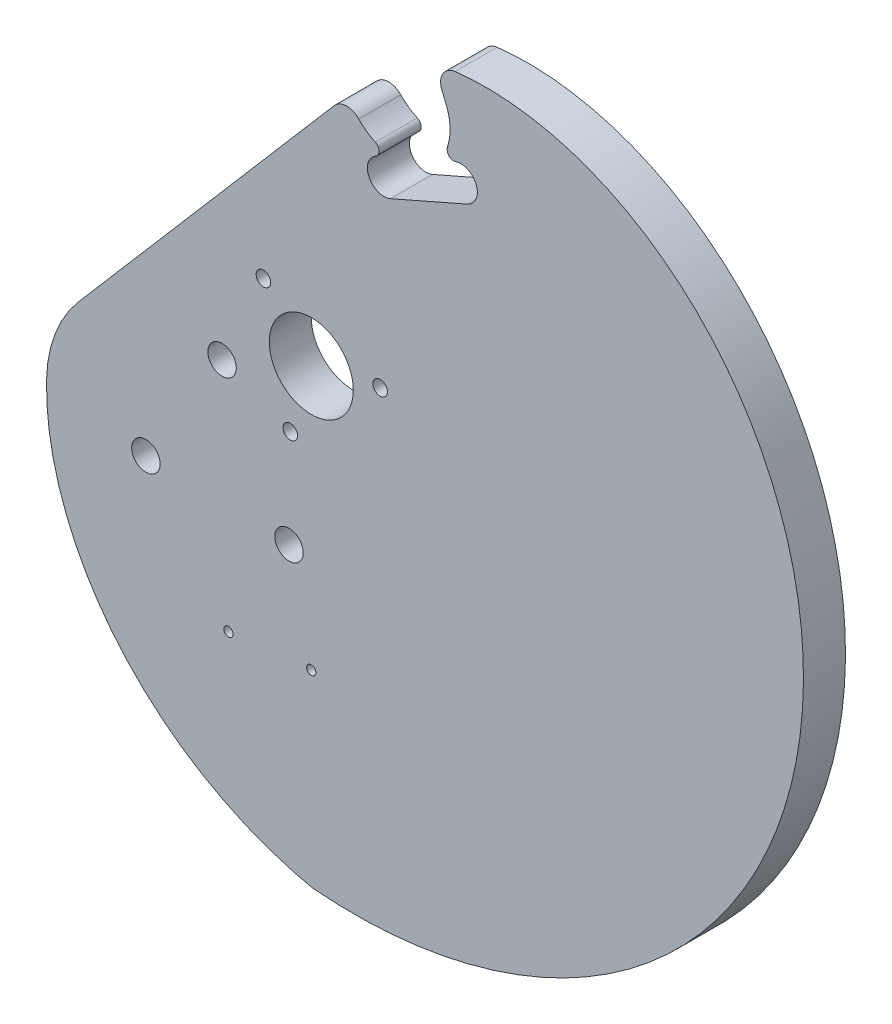
from build123d import *

# Parameters (mm, degrees)
SKETCH1_R               = 6.35
BOSS_EXTRUDE1_DEPTH     = 3.175
CUT_EXTRUDE1_DEPTH      = 102.208623711
CUT_EXTRUDE1_DEPTH_BACK = 102.208623711
FILLET1_R               = 20
FILLET2_R               = 2.5
FILLET3_R               = 1
M4_CLEARANCE_HOLE1_D    = 4.3
M2_CLEARANCE_HOLE1_D    = 2.2
SKETCH18_R              = 0.7
CUT_EXTRUDE5_DEPTH      = 102.357917249


with BuildPart() as part:
    # Sketch1 → Boss-Extrude1 (new, symmetric)
    with BuildSketch(Plane.XY):
        with BuildLine():
            ThreePointArc((11.984914181, 27.895733584), (8.691133377, 29.180649151), (9.976048944, 32.474429955))
            Line((9.976048944, 32.474429955), (12.234616167, 33.46535768))
            ThreePointArc((12.234616167, 33.46535768), (8.26006825, 34.969173712), (5.615201844, 38.295308932))
            Line((5.615201844, 38.295308932), (3.856119442, 42.419673356))
            add(Edge.make_bspline(
                [(3.856119442, 42.419673356), (3.804269194, 42.380475154), (3.486745937, 42.138972836), (2.912619563, 41.685826384), (2.149082762, 41.044776761), (1.408732666, 40.385653153), (0.69201842, 39.710962437), (-0.000702823, 39.023274092), (-0.669224606, 38.325164066), (-1.313490613, 37.619209289), (-1.933594741, 36.907981167), (-2.529780734, 36.194039342), (-3.102441662, 35.479925366), (-3.652119172, 34.768156406), (-4.179502537, 34.061218936), (-4.68542751, 33.361562432), (-5.170874981, 32.671593072), (-5.636969475, 31.993667421), (-6.084977486, 31.330086125), (-6.5163057, 30.68308757), (-6.932499191, 30.054841594), (-7.335239472, 29.447442991), (-7.726343211, 28.862905788), (-8.107759261, 28.30315506), (-8.481572996, 27.770028153), (-8.850055929, 27.265150233), (-9.21599154, 26.789707359), (-9.58007402, 26.342396401), (-9.943199031, 25.921274986), (-10.306211946, 25.524302901), (-10.669815304, 25.149428396), (-11.03457423, 24.794597749), (-11.400917427, 24.457759077), (-11.769139802, 24.136868148), (-12.139404915, 23.829894257), (-12.511747444, 23.534826559), (-12.886075425, 23.249680558), (-13.262172288, 22.972504592), (-13.639698706, 22.701386132), (-14.018194373, 22.4344578), (-14.397079826, 22.169903041), (-14.775658393, 21.905961469), (-15.153118349, 21.640933911), (-15.528535328, 21.37318718), (-15.900874865, 21.101158728), (-16.268995598, 20.823360748), (-16.631651048, 20.538385549), (-16.987497448, 20.244905703), (-17.335071725, 19.941700072), (-17.674482118, 19.629485326), (-18.005889299, 19.308945872), (-18.329486913, 18.98074786), (-18.645506177, 18.6455329), (-18.954213469, 18.303917657), (-19.255909475, 17.956492143), (-19.550927855, 17.603818409), (-19.839633983, 17.246429189), (-20.122423608, 16.884826615), (-20.39972148, 16.519480973), (-20.671979932, 16.15082951), (-20.93967742, 15.77927529), (-21.203317027, 15.405186109), (-21.463424922, 15.028893458), (-21.720548787, 14.650691546), (-21.975256201, 14.270836377), (-22.228133, 13.889544888), (-22.479781587, 13.506994147), (-22.730819224, 13.123320602), (-22.981876279, 12.738619403), (-23.233594452, 12.35294377), (-23.486624965, 11.966304432), (-23.741626724, 11.578669117), (-23.999264462, 11.189962103), (-24.260206854, 10.800063825), (-24.52512461, 10.408810538), (-24.794688561, 10.015994037), (-25.069567717, 9.621361426), (-25.350427363, 9.224614974), (-25.637926993, 8.8254119), (-25.932718851, 8.423364715), (-26.235444149, 8.018039723), (-26.546738212, 7.608962846), (-26.867193334, 7.195608336), (-27.197393741, 6.777566684), (-27.537037782, 6.353934602), (-27.885559202, 5.923803469), (-28.242374703, 5.486366009), (-28.606855737, 5.040842301), (-28.978345064, 4.586492757), (-29.356154138, 4.122615768), (-29.739565815, 3.648549546), (-30.127835637, 3.163672741), (-30.520193566, 2.667405334), (-30.915845631, 2.159209384), (-31.313975642, 1.638589743), (-31.713746908, 1.10509472), (-32.114303997, 0.558316687), (-32.514774496, -0.002107372), (-32.914270801, -0.576495363), (-33.311891916, -1.165119646), (-33.70672526, -1.768206653), (-34.097848491, -2.385936568), (-34.484331334, -3.01844306), (-34.865237414, -3.665813085), (-35.239626095, -4.328086735), (-35.606554319, -5.00525716), (-35.965078448, -5.697270543), (-36.314256102, -6.404026134), (-36.653147994, -7.125376348), (-36.98081976, -7.861126926), (-37.296343783, -8.611037148), (-37.598801011, -9.374820113), (-37.887282738, -10.15214308), (-38.160892488, -10.942627847), (-38.418747446, -11.745851279), (-38.659981522, -12.561345551), (-38.883742182, -13.388599746), (-39.089211497, -14.227059816), (-39.27554787, -15.076191303), (-39.442240692, -15.935443066), (-39.58900499, -16.804297383), (-39.715531283, -17.682274795), (-39.821534024, -18.56888584), (-39.906736403, -19.463633732), (-39.970874682, -20.366013757), (-40.01369729, -21.27551381), (-40.034965324, -22.191614638), (-40.034452659, -23.113790166), (-40.011946156, -24.041507803), (-39.967245835, -24.974228766), (-39.900165044, -25.911408403), (-39.810530622, -26.852496518), (-39.698183052, -27.796937709), (-39.56297661, -28.744171699), (-39.4047795, -29.693633681), (-39.223473982, -30.64475466), (-39.018956498, -31.596961802), (-38.791137779, -32.549678783), (-38.539942955, -33.502326148), (-38.265311644, -34.454321664), (-37.967198044, -35.405080681), (-37.645571006, -36.354016496), (-37.300414107, -37.300540716), (-36.931725709, -38.244063627), (-36.539519007, -39.18399456), (-36.123822074, -40.119742265), (-35.684677893, -41.050715279), (-35.222144381, -41.976322302), (-34.736294403, -42.89597257), (-34.227215775, -43.809076229), (-33.695011264, -44.715044715), (-33.139798572, -45.613291121), (-32.561710315, -46.503230581), (-31.960893988, -47.384280643), (-31.337511928, -48.255861642), (-30.69174126, -49.117397078), (-30.023773839, -49.96831399), (-29.333816181, -50.808043326), (-28.622089382, -51.636020317), (-27.888829033, -52.451684847), (-27.134285123, -53.25448182), (-26.358721931, -54.04386153), (-25.562417912, -54.819280022), (-24.745665571, -55.580199454), (-23.908771332, -56.326088459), (-23.052055394, -57.0564225), (-22.175851579, -57.770684224), (-21.280507172, -58.468363812), (-20.366382752, -59.148959324), (-19.433852012, -59.811977048), (-18.483301577, -60.456931829), (-17.515130802, -61.083347415), (-16.529751575, -61.690756781), (-15.527588097, -62.278702456), (-14.50907667, -62.846736843), (-13.474665463, -63.39442255), (-12.424814268, -63.921332635), (-11.359994294, -64.427051169), (-10.280687768, -64.911172569), (-9.187388219, -65.373305515), (-8.080598179, -65.813059652), (-6.960836498, -66.230096831), (-5.828609627, -66.623940268), (-4.684517934, -66.994691537), (-3.528855652, -67.340343195), (-2.3631095, -67.666856553), (-1.184338477, -67.950378607), (-0.400093515, -68.169065005), (0, -68.230921715)],
                knots=[0.595074645, 0.595074645, 0.595074645, 0.595074645, 0.59561552, 0.598394199, 0.601160164, 0.603910525, 0.606641733, 0.609350191, 0.612032273, 0.614684334, 0.617302722, 0.619883791, 0.622423916, 0.624919509, 0.627367038, 0.629763043, 0.632104166, 0.634387177, 0.636609005, 0.638766786, 0.640857908, 0.642880081, 0.644831406, 0.646710483, 0.648516525, 0.650249514, 0.65191136, 0.653508519, 0.655048349, 0.65653798, 0.657984241, 0.659393583, 0.66077201, 0.662125022, 0.663457568, 0.664774018, 0.666078151, 0.667373165, 0.668661696, 0.669945853, 0.671227263, 0.672507127, 0.673786273, 0.67506522, 0.676344239, 0.677623416, 0.678902717, 0.68018205, 0.681461324, 0.682740438, 0.684019262, 0.685297659, 0.686575488, 0.687852615, 0.689128915, 0.690404281, 0.691678632, 0.692951916, 0.694224122, 0.695495279, 0.696765474, 0.698034846, 0.699303605, 0.70057203, 0.70184048, 0.703109399, 0.704379325, 0.705650892, 0.706924838, 0.708202013, 0.709483377, 0.710770009, 0.712063109, 0.713363997, 0.714674119, 0.715995039, 0.717328447, 0.718676146, 0.720040056, 0.721422204, 0.722824718, 0.724249822, 0.725699824, 0.727177002, 0.72868281, 0.730218172, 0.731783831, 0.733380363, 0.735008197, 0.736667628, 0.738358831, 0.740081872, 0.741836722, 0.743623264, 0.745441305, 0.747290584, 0.749170776, 0.751081502, 0.753022336, 0.754992805, 0.756992401, 0.759020578, 0.761076761, 0.763160347, 0.76527071, 0.767407202, 0.769569155, 0.771755887, 0.7739667, 0.776200882, 0.778457713, 0.780736462, 0.783036392, 0.785356757, 0.787696808, 0.790055792, 0.792432952, 0.794827532, 0.797238799, 0.799666426, 0.802110394, 0.804570687, 0.807047284, 0.809540165, 0.812049305, 0.814574675, 0.817116246, 0.819673984, 0.822247852, 0.824837811, 0.82744382, 0.830065834, 0.832703806, 0.835357687, 0.838027424, 0.840712962, 0.843414244, 0.84613121, 0.848863798, 0.851611942, 0.854375576, 0.857154631, 0.859949033, 0.862758708, 0.865583582, 0.868423573, 0.871278601, 0.874148584, 0.877033434, 0.879933066, 0.882847387, 0.885776307, 0.888719732, 0.891677564, 0.894649707, 0.897636058, 0.900636516, 0.903650977, 0.906679333, 0.909721476, 0.912777297, 0.915846682, 0.918929518, 0.922025687, 0.925135072, 0.928257554, 0.931393009, 0.934541315, 0.937702347, 0.940875975, 0.944062073, 0.947260508, 0.950471149, 0.95369386, 0.956928506, 0.960174949, 0.96343305, 0.966702667, 0.969983657, 0.973275876, 0.976579178, 0.979893415, 0.983218438, 0.986554095, 0.989900235, 0.993256703, 0.996623344, 1, 1, 1, 1], degree=3))
            add(Edge.make_bspline(
                [(0, -68.230921715), (0.393333706, -68.291733321), (1.194961176, -68.321276753), (2.388868431, -68.414811628), (3.58891617, -68.470136134), (4.791044831, -68.510535556), (5.995946289, -68.52954927), (7.203026535, -68.528713614), (8.412027616, -68.507423129), (9.62259203, -68.465654591), (10.83437986, -68.403235569), (12.047037443, -68.320041284), (13.260205927, -68.215942066), (14.473519127, -68.090817818), (15.686604264, -67.944554476), (16.899081946, -67.777045295), (18.110566359, -67.588190842), (19.320665416, -67.377899329), (20.528980925, -67.146086849), (21.73510877, -66.892677633), (22.938639087, -66.6176043), (24.139156466, -66.320808097), (25.336240146, -66.002239142), (26.529464226, -65.661856654), (27.718397887, -65.299629187), (28.90260561, -64.915534847), (30.081647414, -64.509561514), (31.255079097, -64.081707052), (32.42245248, -63.631979515), (33.58331567, -63.160397343), (34.737213315, -62.666989561), (35.883686879, -62.151795956), (37.022274916, -61.614867262), (38.152513354, -61.056265327), (39.273935784, -60.476063279), (40.386073758, -59.87434568), (41.488457085, -59.251208675), (42.580614147, -58.606760131), (43.662072205, -57.941119771), (44.732357722, -57.254419292), (45.790996682, -56.546802486), (46.837514925, -55.81842534), (47.871438475, -55.069456136), (48.89229388, -54.300075538), (49.899608554, -53.51047667), (50.892911122, -52.700865183), (51.871731772, -51.87145932), (52.835602603, -51.022489959), (53.784057989, -50.154200657), (54.71663493, -49.26684768), (55.632873421, -48.360700021), (56.532316811, -47.436039411), (57.414512174, -46.493160317), (58.279010671, -45.532369935), (59.125367928, -44.553988165), (59.953144401, -43.558347582), (60.761905749, -42.545793391), (61.55122321, -41.516683378), (62.320673971, -40.471387842), (63.069841543, -39.410289525), (63.798316132, -38.333783527), (64.505695017, -37.242277204), (65.191582915, -36.13619007), (65.85559236, -35.015953676), (66.497344063, -33.882011479), (67.11646729, -32.734818707), (67.71260022, -31.574842209), (68.285390316, -30.402560293), (68.834494677, -29.218462553), (69.359580408, -28.023049692), (69.860324965, -26.816833323), (70.336416512, -25.60033577), (70.787554269, -24.374089852), (71.213448854, -23.13863866), (71.613822626, -21.894535318), (71.988410015, -20.642342743), (72.336957858, -19.382633384), (72.659225719, -18.115988959), (72.954986211, -16.843000179), (73.224025309, -15.564266461), (73.466142659, -14.28039563), (73.681151874, -12.992003617), (73.868880836, -11.699714142), (74.029171977, -10.404158388), (74.161882563, -9.10597467), (74.266884966, -7.805808087), (74.344066927, -6.504310174), (74.393331816, -5.202138538), (74.414598879, -3.89995649), (74.407803478, -2.598432666), (74.372897323, -1.29824064), (74.309848696, -5.853e-05), (74.218642658, 1.295431404), (74.099281259, 2.587543173), (73.95178373, 3.875587471), (73.776186663, 5.158872107), (73.572544188, 6.43670243), (73.340928136, 7.708381771), (73.081428188, 8.973211889), (72.794152019, 10.230493418), (72.47922543, 11.479526328), (72.13679246, 12.719610386), (71.767015501, 13.950045625), (71.37007539, 15.170132817), (70.946171493, 16.379173951), (70.495521777, 17.576472716), (70.018362872, 18.761334989), (69.514950114, 19.933069325), (68.985557583, 21.090987453), (68.430478125, 22.234404772), (67.850023359, 23.362640855), (67.244523678, 24.47501995), (66.614328227, 25.570871489), (65.959804877, 26.649530597), (65.281340181, 27.710338599), (64.579339317, 28.752643533), (63.85422602, 29.775800665), (63.106442497, 30.779173), (62.33644933, 31.762131799), (61.544725366, 32.724057086), (60.731767601, 33.66433818), (59.898090995, 34.582374149), (59.044228508, 35.477574541), (58.170730235, 36.349359075), (57.278166357, 37.197160694), (56.367121668, 38.020410915), (55.438270074, 38.818621759), (54.492318121, 39.591335254), (53.529982536, 40.3381068), (52.551992493, 41.058512637), (51.559087829, 41.752148676), (50.552018856, 42.418631155), (49.531545735, 43.057596786), (48.498437965, 43.668703015), (47.453473832, 44.251628246), (46.397439863, 44.806072049), (45.331130274, 45.331755356), (44.255346411, 45.828420647), (43.17089619, 46.295832116), (42.078593533, 46.733775825), (40.979257798, 47.142059848), (39.873713209, 47.520514394), (38.762788284, 47.868991924), (37.647315256, 48.187367242), (36.528129497, 48.475537585), (35.406068937, 48.733422689), (34.281973488, 48.960964845), (33.156684455, 49.158128938), (32.031043959, 49.324902476), (30.905894352, 49.461295599), (29.78207764, 49.567341079), (28.66043489, 49.643094299), (27.541805663, 49.688633226), (26.427027423, 49.704058363), (25.316934962, 49.689492689), (24.212359828, 49.645081585), (23.114129743, 49.570992746), (22.023068037, 49.46741608), (20.939993076, 49.334563587), (19.865717696, 49.172669234), (19.050939925, 49.026743912), (18.594215776, 48.936446476), (18.491236259, 48.915651329)],
                knots=[0, 0, 0, 0, 0.003319606, 0.00664483, 0.00997572, 0.013312315, 0.016654652, 0.020002764, 0.023356679, 0.026716422, 0.030082012, 0.033453467, 0.036830797, 0.040214011, 0.043603114, 0.046998106, 0.050398984, 0.05380574, 0.057218364, 0.060636841, 0.064061153, 0.067491279, 0.070927192, 0.074368865, 0.077816264, 0.081269354, 0.084728096, 0.088192446, 0.09166236, 0.095137787, 0.098618675, 0.102104968, 0.105596607, 0.10909353, 0.112595671, 0.116102963, 0.119615332, 0.123132706, 0.126655005, 0.130182149, 0.133714056, 0.137250637, 0.140791804, 0.144337465, 0.147887524, 0.151441884, 0.155000443, 0.158563099, 0.162129745, 0.165700272, 0.169274569, 0.172852522, 0.176434014, 0.180018926, 0.183607137, 0.187198521, 0.190792953, 0.194390304, 0.197990441, 0.201593231, 0.205198539, 0.208806224, 0.212416148, 0.216028167, 0.219642135, 0.223257906, 0.226875331, 0.230494258, 0.234114533, 0.237736001, 0.241358506, 0.244981886, 0.248605983, 0.252230632, 0.255855669, 0.259480928, 0.263106241, 0.266731437, 0.270356345, 0.273980794, 0.277604607, 0.281227611, 0.284849627, 0.288470478, 0.292089983, 0.295707963, 0.299324234, 0.302938615, 0.306550921, 0.310160967, 0.313768569, 0.317373538, 0.320975689, 0.324574833, 0.328170782, 0.331763348, 0.335352341, 0.338937573, 0.342518853, 0.346095993, 0.349668803, 0.353237093, 0.356800674, 0.360359359, 0.363912958, 0.367461284, 0.37100415, 0.37454137, 0.37807276, 0.381598135, 0.385117313, 0.388630113, 0.392136355, 0.395635862, 0.399128458, 0.402613969, 0.406092224, 0.409563054, 0.413026294, 0.416481778, 0.419929348, 0.423368847, 0.426800121, 0.43022302, 0.4336374, 0.437043112, 0.440439966, 0.443827754, 0.447206268, 0.450575308, 0.453934675, 0.457284173, 0.460623612, 0.463952804, 0.467271567, 0.470579721, 0.473877092, 0.477163509, 0.480438807, 0.483702825, 0.486955407, 0.490196401, 0.493425661, 0.496643048, 0.499848424, 0.50304166, 0.506222633, 0.509391223, 0.512547319, 0.515690814, 0.518821608, 0.521939609, 0.52504473, 0.528136891, 0.531216019, 0.53428205, 0.537334925, 0.540374595, 0.543401017, 0.546414157, 0.549413988, 0.550288202, 0.550288202, 0.550288202, 0.550288202], degree=3))
            Line((18.491236259, 48.915651329), (20.341962163, 44.576418519))
            ThreePointArc((20.341962163, 44.576418519), (20.922430656, 40.447066292), (19.347370503, 36.586019931))
            Line((19.347370503, 36.586019931), (21.605937727, 37.576947657))
            ThreePointArc((21.605937727, 37.576947657), (24.899718531, 36.29203209), (23.614802964, 32.998251286))
            Line((23.614802964, 32.998251286), (11.984914181, 27.895733584))
        make_face()
        Circle(SKETCH1_R, mode=Mode.SUBTRACT)
    extrude(amount=BOSS_EXTRUDE1_DEPTH, both=True)

    # Sketch2 → Cut-Extrude1 (cut, two sides: drawn at the far end of the back side and taken through both)
    with BuildSketch(Plane.XY.offset(-CUT_EXTRUDE1_DEPTH_BACK)):
        Polygon((-35.700141367, -3.650772794), (-7.072677907, 43.311946145), (4.622228263, 43.311946145), (7.657062795, 40.706225638), (-41.200196706, -16.19692185), align=None)
    extrude(amount=CUT_EXTRUDE1_DEPTH + CUT_EXTRUDE1_DEPTH_BACK, mode=Mode.SUBTRACT)

    # Fillet1
    fillet1_edges = [part.edges().sort_by_distance(p)[0] for p in [
        (-38.918855467, -13.539885857, -1.5874997),
    ]]
    fillet(fillet1_edges, radius=FILLET1_R)

    # Fillet2
    fillet2_edges = [part.edges().sort_by_distance(p)[0] for p in [
        (18.491236259, 48.915651329, -1.5875),
        (5.605855522, 38.317222424, 0),
    ]]
    fillet(fillet2_edges, radius=FILLET2_R)

    # Fillet3
    fillet3_edges = [part.edges().sort_by_distance(p)[0] for p in [
        (19.347370503, 36.586019931, 0),
        (12.234616167, 33.46535768, 0),
    ]]
    fillet(fillet3_edges, radius=FILLET3_R)

    # M4 Clearance Hole1 (through all)
    with Locations(Plane.XY.offset(3.175)):
        with Locations((-13.488047982, -5.9360377), (-3.367538379, -25.076378767), (-25.003814781, -24.270826649)):
            Hole(M4_CLEARANCE_HOLE1_D / 2)

    # M2 Clearance Hole1 (through all)
    with Locations(Plane(origin=(0, 0, -3.175), x_dir=(-1, 0, 0), z_dir=(0, 0, -1))):
        with Locations((7.233951111, 7.840674418), (3.173247673, -10.185122641), (-10.407198784, 2.344448223)):
            Hole(M2_CLEARANCE_HOLE1_D / 2)

    # Sketch18 → Cut-Extrude5 (cut, through all)
    with BuildSketch(Plane.XY.offset(3.175)):
        with Locations((-12.52460351, -41.04915847)):
            Circle(SKETCH18_R)
        with Locations((0, -39.8190457)):
            Circle(SKETCH18_R)
    extrude(amount=-CUT_EXTRUDE5_DEPTH, mode=Mode.SUBTRACT)


solid = part.part
